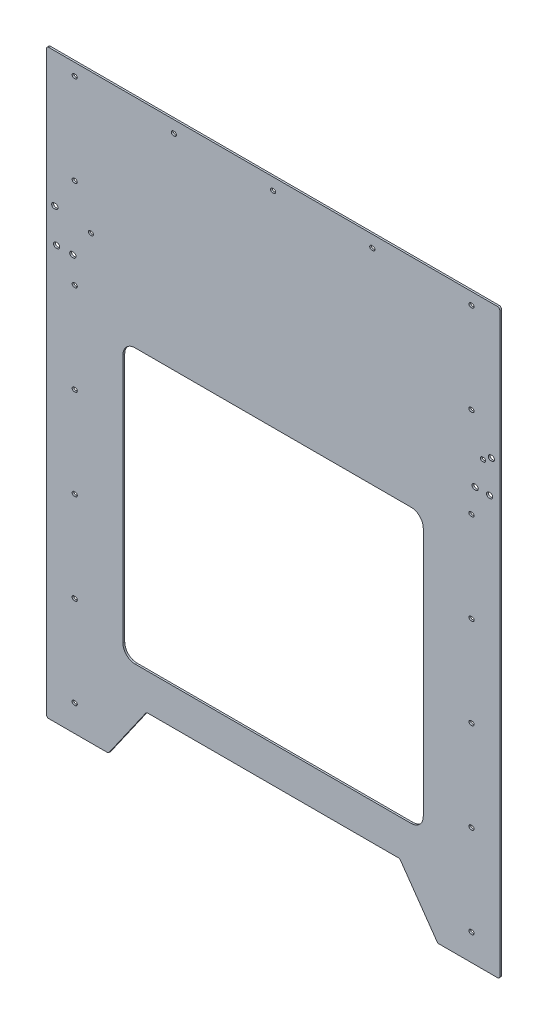
from build123d import *

# Parameters (mm, degrees)
CONVERT_SOLID1_START = -1.5
CONVERT_SOLID1_DEPTH = 1.5


# Read off the part's stored shape, not the designer's step: Convert-Solid1
with BuildPart() as part:
    # Convert-Solid1 outline → Convert-Solid1 (new body)
    with BuildSketch(Plane.XY.offset(CONVERT_SOLID1_START)):
        with BuildLine():
            ThreePointArc((374, 0), (375.414213562, 0.585786438), (376, 2))
            Line((376, 2), (376, 480))
            ThreePointArc((376, 480), (375.414213562, 481.414213562), (374, 482))
            Line((374, 482), (2, 482))
            ThreePointArc((2, 482), (0.585786438, 481.414213562), (0, 480))
            Line((0, 480), (0, 2))
            ThreePointArc((0, 2), (0.585786438, 0.585786438), (2, 0))
            Line((2, 0), (50.458688877, 0))
            ThreePointArc((50.458688877, 0), (51.382309639, 0.226042647), (52.097152718, 0.853075311))
            Line((52.097152718, 0.853075311), (82.402847282, 44.146924689))
            ThreePointArc((82.402847282, 44.146924689), (83.117690361, 44.773957353), (84.041311123, 45))
            Line((84.041311123, 45), (291.958688877, 45))
            ThreePointArc((291.958688877, 45), (292.882309639, 44.773957353), (293.597152718, 44.146924689))
            Line((293.597152718, 44.146924689), (323.902847282, 0.853075311))
            ThreePointArc((323.902847282, 0.853075311), (324.617690361, 0.226042647), (325.541311123, 0))
            Line((325.541311123, 0), (374, 0))
        make_face()
        with BuildLine():
            Line((23, 23.65), (24, 23.65))
            ThreePointArc((24, 23.65), (25.65, 22), (24, 20.35))
            Line((24, 20.35), (23, 20.35))
            ThreePointArc((23, 20.35), (21.35, 22), (23, 23.65))
        make_face(mode=Mode.SUBTRACT)
        with BuildLine():
            Line((23, 98.65), (24, 98.65))
            ThreePointArc((24, 98.65), (25.65, 97), (24, 95.35))
            Line((24, 95.35), (23, 95.35))
            ThreePointArc((23, 95.35), (21.35, 97), (23, 98.65))
        make_face(mode=Mode.SUBTRACT)
        with BuildLine():
            Line((23, 173.65), (24, 173.65))
            ThreePointArc((24, 173.65), (25.65, 172), (24, 170.35))
            Line((24, 170.35), (23, 170.35))
            ThreePointArc((23, 170.35), (21.35, 172), (23, 173.65))
        make_face(mode=Mode.SUBTRACT)
        with BuildLine():
            Line((352, 23.65), (353, 23.65))
            ThreePointArc((353, 23.65), (354.65, 22), (353, 20.35))
            Line((353, 20.35), (352, 20.35))
            ThreePointArc((352, 20.35), (350.35, 22), (352, 23.65))
        make_face(mode=Mode.SUBTRACT)
        with BuildLine():
            Line((352, 98.65), (353, 98.65))
            ThreePointArc((353, 98.65), (354.65, 97), (353, 95.35))
            Line((353, 95.35), (352, 95.35))
            ThreePointArc((352, 95.35), (350.35, 97), (352, 98.65))
        make_face(mode=Mode.SUBTRACT)
        with BuildLine():
            Line((302.5, 75), (73.5, 75))
            ThreePointArc((73.5, 75), (66.428932188, 77.928932188), (63.5, 85))
            Line((63.5, 85), (63.5, 292))
            ThreePointArc((63.5, 292), (66.428932188, 299.071067812), (73.5, 302))
            Line((73.5, 302), (302.5, 302))
            ThreePointArc((302.5, 302), (309.571067812, 299.071067812), (312.5, 292))
            Line((312.5, 292), (312.5, 85))
            ThreePointArc((312.5, 85), (309.571067812, 77.928932188), (302.5, 75))
        make_face(mode=Mode.SUBTRACT)
        with BuildLine():
            Line((352, 173.65), (353, 173.65))
            ThreePointArc((353, 173.65), (354.65, 172), (353, 170.35))
            Line((353, 170.35), (352, 170.35))
            ThreePointArc((352, 170.35), (350.35, 172), (352, 173.65))
        make_face(mode=Mode.SUBTRACT)
        with BuildLine():
            Line((23, 248.65), (24, 248.65))
            ThreePointArc((24, 248.65), (25.65, 247), (24, 245.35))
            Line((24, 245.35), (23, 245.35))
            ThreePointArc((23, 245.35), (21.35, 247), (23, 248.65))
        make_face(mode=Mode.SUBTRACT)
        with BuildLine():
            Line((23, 323.65), (24, 323.65))
            ThreePointArc((24, 323.65), (25.65, 322), (24, 320.35))
            Line((24, 320.35), (23, 320.35))
            ThreePointArc((23, 320.35), (21.35, 322), (23, 323.65))
        make_face(mode=Mode.SUBTRACT)
        with BuildLine():
            Line((7.98683607, 345.178083895), (8.98683607, 345.178083895))
            ThreePointArc((8.98683607, 345.178083895), (11.08683607, 343.078083895), (8.98683607, 340.978083895))
            Line((8.98683607, 340.978083895), (7.98683607, 340.978083895))
            ThreePointArc((7.98683607, 340.978083895), (5.88683607, 343.078083895), (7.98683607, 345.178083895))
        make_face(mode=Mode.SUBTRACT)
        with BuildLine():
            Line((21.48683607, 345.178083895), (22.48683607, 345.178083895))
            ThreePointArc((22.48683607, 345.178083895), (24.58683607, 343.078083895), (22.48683607, 340.978083895))
            Line((22.48683607, 340.978083895), (21.48683607, 340.978083895))
            ThreePointArc((21.48683607, 340.978083895), (19.38683607, 343.078083895), (21.48683607, 345.178083895))
        make_face(mode=Mode.SUBTRACT)
        with BuildLine():
            Line((6.48683607, 372.678083895), (7.48683607, 372.678083895))
            ThreePointArc((7.48683607, 372.678083895), (9.58683607, 370.578083895), (7.48683607, 368.478083895))
            Line((7.48683607, 368.478083895), (6.48683607, 368.478083895))
            ThreePointArc((6.48683607, 368.478083895), (4.38683607, 370.578083895), (6.48683607, 372.678083895))
        make_face(mode=Mode.SUBTRACT)
        with BuildLine():
            Line((36.48683607, 367.728083895), (37.48683607, 367.728083895))
            ThreePointArc((37.48683607, 367.728083895), (39.13683607, 366.078083895), (37.48683607, 364.428083895))
            Line((37.48683607, 364.428083895), (36.48683607, 364.428083895))
            ThreePointArc((36.48683607, 364.428083895), (34.83683607, 366.078083895), (36.48683607, 367.728083895))
        make_face(mode=Mode.SUBTRACT)
        with BuildLine():
            Line((23, 398.65), (24, 398.65))
            ThreePointArc((24, 398.65), (25.65, 397), (24, 395.35))
            Line((24, 395.35), (23, 395.35))
            ThreePointArc((23, 395.35), (21.35, 397), (23, 398.65))
        make_face(mode=Mode.SUBTRACT)
        with BuildLine():
            Line((23, 473.65), (24, 473.65))
            ThreePointArc((24, 473.65), (25.65, 472), (24, 470.35))
            Line((24, 470.35), (23, 470.35))
            ThreePointArc((23, 470.35), (21.35, 472), (23, 473.65))
        make_face(mode=Mode.SUBTRACT)
        with BuildLine():
            Line((105.25, 473.65), (106.25, 473.65))
            ThreePointArc((106.25, 473.65), (107.9, 472), (106.25, 470.35))
            Line((106.25, 470.35), (105.25, 470.35))
            ThreePointArc((105.25, 470.35), (103.6, 472), (105.25, 473.65))
        make_face(mode=Mode.SUBTRACT)
        with BuildLine():
            Line((352, 248.65), (353, 248.65))
            ThreePointArc((353, 248.65), (354.65, 247), (353, 245.35))
            Line((353, 245.35), (352, 245.35))
            ThreePointArc((352, 245.35), (350.35, 247), (352, 248.65))
        make_face(mode=Mode.SUBTRACT)
        with BuildLine():
            Line((352, 323.65), (353, 323.65))
            ThreePointArc((353, 323.65), (354.65, 322), (353, 320.35))
            Line((353, 320.35), (352, 320.35))
            ThreePointArc((352, 320.35), (350.35, 322), (352, 323.65))
        make_face(mode=Mode.SUBTRACT)
        with BuildLine():
            Line((355.01316393, 345.178083895), (356.01316393, 345.178083895))
            ThreePointArc((356.01316393, 345.178083895), (358.11316393, 343.078083895), (356.01316393, 340.978083895))
            Line((356.01316393, 340.978083895), (355.01316393, 340.978083895))
            ThreePointArc((355.01316393, 340.978083895), (352.91316393, 343.078083895), (355.01316393, 345.178083895))
        make_face(mode=Mode.SUBTRACT)
        with BuildLine():
            Line((367.01316393, 345.178083895), (368.01316393, 345.178083895))
            ThreePointArc((368.01316393, 345.178083895), (370.11316393, 343.078083895), (368.01316393, 340.978083895))
            Line((368.01316393, 340.978083895), (367.01316393, 340.978083895))
            ThreePointArc((367.01316393, 340.978083895), (364.91316393, 343.078083895), (367.01316393, 345.178083895))
        make_face(mode=Mode.SUBTRACT)
        with BuildLine():
            Line((187.5, 473.65), (188.5, 473.65))
            ThreePointArc((188.5, 473.65), (190.15, 472), (188.5, 470.35))
            Line((188.5, 470.35), (187.5, 470.35))
            ThreePointArc((187.5, 470.35), (185.85, 472), (187.5, 473.65))
        make_face(mode=Mode.SUBTRACT)
        with BuildLine():
            Line((269.75, 473.65), (270.75, 473.65))
            ThreePointArc((270.75, 473.65), (272.4, 472), (270.75, 470.35))
            Line((270.75, 470.35), (269.75, 470.35))
            ThreePointArc((269.75, 470.35), (268.1, 472), (269.75, 473.65))
        make_face(mode=Mode.SUBTRACT)
        with BuildLine():
            Line((361.51316393, 367.728083895), (362.51316393, 367.728083895))
            ThreePointArc((362.51316393, 367.728083895), (364.16316393, 366.078083895), (362.51316393, 364.428083895))
            Line((362.51316393, 364.428083895), (361.51316393, 364.428083895))
            ThreePointArc((361.51316393, 364.428083895), (359.86316393, 366.078083895), (361.51316393, 367.728083895))
        make_face(mode=Mode.SUBTRACT)
        with BuildLine():
            Line((368.51316393, 372.678083895), (369.51316393, 372.678083895))
            ThreePointArc((369.51316393, 372.678083895), (371.61316393, 370.578083895), (369.51316393, 368.478083895))
            Line((369.51316393, 368.478083895), (368.51316393, 368.478083895))
            ThreePointArc((368.51316393, 368.478083895), (366.41316393, 370.578083895), (368.51316393, 372.678083895))
        make_face(mode=Mode.SUBTRACT)
        with BuildLine():
            Line((352, 398.65), (353, 398.65))
            ThreePointArc((353, 398.65), (354.65, 397), (353, 395.35))
            Line((353, 395.35), (352, 395.35))
            ThreePointArc((352, 395.35), (350.35, 397), (352, 398.65))
        make_face(mode=Mode.SUBTRACT)
        with BuildLine():
            Line((352, 473.65), (353, 473.65))
            ThreePointArc((353, 473.65), (354.65, 472), (353, 470.35))
            Line((353, 470.35), (352, 470.35))
            ThreePointArc((352, 470.35), (350.35, 472), (352, 473.65))
        make_face(mode=Mode.SUBTRACT)
    extrude(amount=CONVERT_SOLID1_DEPTH)


solid = part.part
